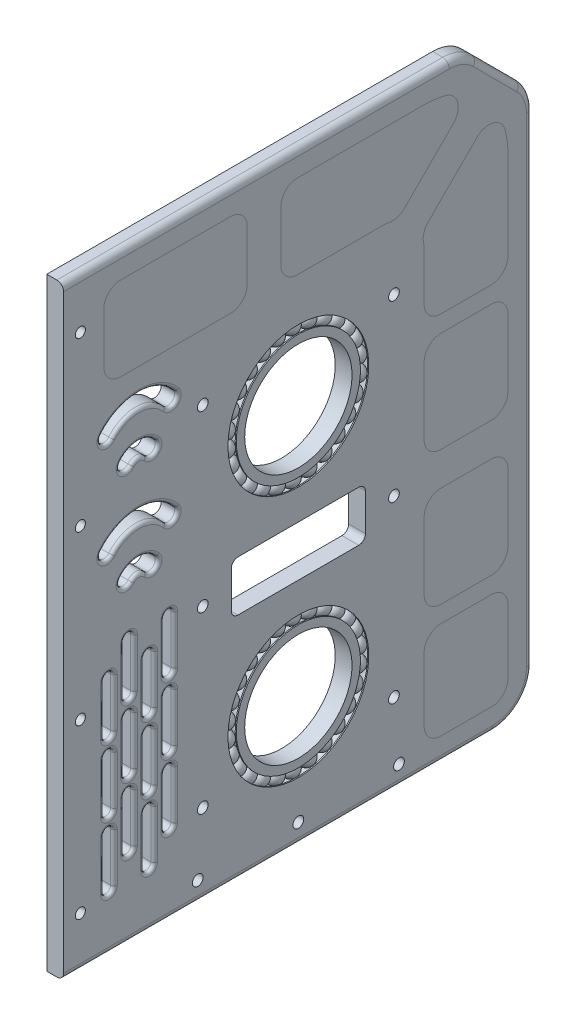
from build123d import *

# Parameters (mm, degrees)
SKETCH1_W             = 140
SKETCH1_H             = 180
BOSS_EXTRUDE1_DEPTH   = 5
CHAMFER1_SIZE         = 20
FILLET6_R             = 12
SKETCH18_R            = 23.5
CUT_EXTRUDE4_DEPTH    = 115.127122105
F_3_0MM_DOWEL_HOLE1_D = 3
CIRPATTERN2_COUNT     = 26
SKETCH33_R            = 1.6
CUT_EXTRUDE6_DEPTH    = 115.127122105
CUT_EXTRUDE7_DEPTH    = 5
SKETCH35_W            = 42.75
SKETCH35_H            = 25
SKETCH35_W_2          = 25
SKETCH35_H_2          = 30
CUT_EXTRUDE8_DEPTH    = 115.127122105
FILLET4_R             = 5
BOSS_EXTRUDE4_DEPTH   = 5
BOSS_EXTRUDE4_2_DEPTH = 5
BOSS_EXTRUDE4_3_DEPTH = 5
BOSS_EXTRUDE4_4_DEPTH = 5
BOSS_EXTRUDE4_5_DEPTH = 5
BOSS_EXTRUDE4_6_DEPTH = 5
SKETCH37_R            = 1.6
CUT_EXTRUDE9_DEPTH    = 115.127122105
FILLET5_R             = 2
FILLET7_R             = 1


with BuildPart() as part:
    # Sketch1 → Boss-Extrude1 (new body)
    with BuildSketch(Plane(origin=(0, 0, 0), x_dir=(0, 0, -1), z_dir=(1, 0, 0))):
        Rectangle(SKETCH1_W, SKETCH1_H)
    extrude(amount=BOSS_EXTRUDE1_DEPTH)

    # Chamfer1
    chamfer1_edges = [part.edges().sort_by_distance(p)[0] for p in [
        (2.5, 90, -70),
    ]]
    chamfer(chamfer1_edges, length=CHAMFER1_SIZE)

    # Fillet6
    fillet6_edges = [part.edges().sort_by_distance(p)[0] for p in [
        (2.5, 90, -50),
        (2.5, 70, -70),
        (2.5, -90, -70),
    ]]
    fillet(fillet6_edges, radius=FILLET6_R)

    # Sketch18 → Cut-Extrude4 (cut, through all)
    with BuildSketch(Plane(origin=(5, 0, 0), x_dir=(0, 0, -1), z_dir=(1, 0, 0))):
        with Locations((0, 23.5)):
            Circle(SKETCH18_R)
        with Locations((0, -51.5)):
            Circle(SKETCH18_R)
    extrude(amount=-CUT_EXTRUDE4_DEPTH, mode=Mode.SUBTRACT)

    # Ø3.0mm Dowel Hole1 (through all)
    with Locations(Plane(origin=(5, 0, 0), x_dir=(0, 0, -1), z_dir=(1, 0, 0))):
        with Locations((-65, -75), (-65, -25), (-65, 25), (-65, 75)):
            Hole(F_3_0MM_DOWEL_HOLE1_D / 2)


with BuildPart() as body_2:
    # Sketch19 → Revolve1 (revolve)
    with BuildSketch(Plane.XY, mode=Mode.PRIVATE) as revolve1_sk:
        with BuildLine():
            Line((5, 47), (0, 47))
            Line((0, 47), (0, 44.5))
            Line((0, 44.5), (0.334936491, 44.5))
            ThreePointArc((0.334936491, 44.5), (2.5, 45.75), (4.665063509, 44.5))
            Line((4.665063509, 44.5), (5, 44.5))
            Line((5, 44.5), (5, 47))
        make_face()
        with BuildLine():
            Line((5, 39.5), (0, 39.5))
            Line((0, 39.5), (0, 42))
            Line((0, 42), (0.334936491, 42))
            ThreePointArc((0.334936491, 42), (2.5, 40.75), (4.665063509, 42))
            Line((4.665063509, 42), (5, 42))
            Line((5, 42), (5, 39.5))
        make_face()
    revolve(revolve1_sk.sketch.rotate(Axis((5.915063509, 23.5, 0), (1, 0, 0)), 90), axis=Axis((5.915063509, 23.5, 0), (1, 0, 0)))


with BuildPart() as body_3:
    # Sketch20 → Revolve2 (revolve)
    with BuildSketch(Plane.XY):
        with BuildLine():
            Line((4.89, 43.25), (0.11, 43.25))
            ThreePointArc((0.11, 43.25), (2.5, 40.86), (4.89, 43.25))
        make_face()
    revolve(axis=Axis((6.375608652, 43.25, 0), (-1, 0, 0)))


with BuildPart() as cirpattern2_1:
    # CirPattern2: pattern copy
    add(body_3.part.rotate(Axis((0, 23.5, 0), (1, 0, 0)), 1 * 360 / CIRPATTERN2_COUNT))


with BuildPart() as cirpattern2_2:
    # CirPattern2: pattern copy
    add(body_3.part.rotate(Axis((0, 23.5, 0), (1, 0, 0)), 2 * 360 / CIRPATTERN2_COUNT))


with BuildPart() as cirpattern2_3:
    # CirPattern2: pattern copy
    add(body_3.part.rotate(Axis((0, 23.5, 0), (1, 0, 0)), 3 * 360 / CIRPATTERN2_COUNT))


with BuildPart() as cirpattern2_4:
    # CirPattern2: pattern copy
    add(body_3.part.rotate(Axis((0, 23.5, 0), (1, 0, 0)), 4 * 360 / CIRPATTERN2_COUNT))


with BuildPart() as cirpattern2_5:
    # CirPattern2: pattern copy
    add(body_3.part.rotate(Axis((0, 23.5, 0), (1, 0, 0)), 5 * 360 / CIRPATTERN2_COUNT))


with BuildPart() as cirpattern2_6:
    # CirPattern2: pattern copy
    add(body_3.part.rotate(Axis((0, 23.5, 0), (1, 0, 0)), 6 * 360 / CIRPATTERN2_COUNT))


with BuildPart() as cirpattern2_7:
    # CirPattern2: pattern copy
    add(body_3.part.rotate(Axis((0, 23.5, 0), (1, 0, 0)), 7 * 360 / CIRPATTERN2_COUNT))


with BuildPart() as cirpattern2_8:
    # CirPattern2: pattern copy
    add(body_3.part.rotate(Axis((0, 23.5, 0), (1, 0, 0)), 8 * 360 / CIRPATTERN2_COUNT))


with BuildPart() as cirpattern2_9:
    # CirPattern2: pattern copy
    add(body_3.part.rotate(Axis((0, 23.5, 0), (1, 0, 0)), 9 * 360 / CIRPATTERN2_COUNT))


with BuildPart() as cirpattern2_10:
    # CirPattern2: pattern copy
    add(body_3.part.rotate(Axis((0, 23.5, 0), (1, 0, 0)), 10 * 360 / CIRPATTERN2_COUNT))


with BuildPart() as cirpattern2_11:
    # CirPattern2: pattern copy
    add(body_3.part.rotate(Axis((0, 23.5, 0), (1, 0, 0)), 11 * 360 / CIRPATTERN2_COUNT))


with BuildPart() as cirpattern2_12:
    # CirPattern2: pattern copy
    add(body_3.part.rotate(Axis((0, 23.5, 0), (1, 0, 0)), 12 * 360 / CIRPATTERN2_COUNT))


with BuildPart() as cirpattern2_13:
    # CirPattern2: pattern copy
    add(body_3.part.rotate(Axis((0, 23.5, 0), (1, 0, 0)), 13 * 360 / CIRPATTERN2_COUNT))


with BuildPart() as cirpattern2_14:
    # CirPattern2: pattern copy
    add(body_3.part.rotate(Axis((0, 23.5, 0), (1, 0, 0)), 14 * 360 / CIRPATTERN2_COUNT))


with BuildPart() as cirpattern2_15:
    # CirPattern2: pattern copy
    add(body_3.part.rotate(Axis((0, 23.5, 0), (1, 0, 0)), 15 * 360 / CIRPATTERN2_COUNT))


with BuildPart() as cirpattern2_16:
    # CirPattern2: pattern copy
    add(body_3.part.rotate(Axis((0, 23.5, 0), (1, 0, 0)), 16 * 360 / CIRPATTERN2_COUNT))


with BuildPart() as cirpattern2_17:
    # CirPattern2: pattern copy
    add(body_3.part.rotate(Axis((0, 23.5, 0), (1, 0, 0)), 17 * 360 / CIRPATTERN2_COUNT))


with BuildPart() as cirpattern2_18:
    # CirPattern2: pattern copy
    add(body_3.part.rotate(Axis((0, 23.5, 0), (1, 0, 0)), 18 * 360 / CIRPATTERN2_COUNT))


with BuildPart() as cirpattern2_19:
    # CirPattern2: pattern copy
    add(body_3.part.rotate(Axis((0, 23.5, 0), (1, 0, 0)), 19 * 360 / CIRPATTERN2_COUNT))


with BuildPart() as cirpattern2_20:
    # CirPattern2: pattern copy
    add(body_3.part.rotate(Axis((0, 23.5, 0), (1, 0, 0)), 20 * 360 / CIRPATTERN2_COUNT))


with BuildPart() as cirpattern2_21:
    # CirPattern2: pattern copy
    add(body_3.part.rotate(Axis((0, 23.5, 0), (1, 0, 0)), 21 * 360 / CIRPATTERN2_COUNT))


with BuildPart() as cirpattern2_22:
    # CirPattern2: pattern copy
    add(body_3.part.rotate(Axis((0, 23.5, 0), (1, 0, 0)), 22 * 360 / CIRPATTERN2_COUNT))


with BuildPart() as cirpattern2_23:
    # CirPattern2: pattern copy
    add(body_3.part.rotate(Axis((0, 23.5, 0), (1, 0, 0)), 23 * 360 / CIRPATTERN2_COUNT))


with BuildPart() as cirpattern2_24:
    # CirPattern2: pattern copy
    add(body_3.part.rotate(Axis((0, 23.5, 0), (1, 0, 0)), 24 * 360 / CIRPATTERN2_COUNT))


with BuildPart() as cirpattern2_25:
    # CirPattern2: pattern copy
    add(body_3.part.rotate(Axis((0, 23.5, 0), (1, 0, 0)), 25 * 360 / CIRPATTERN2_COUNT))


with BuildPart() as body_29:
    # Mirror4: mirrored copy
    add(body_2.part.mirror(Plane.ZX.offset(-14)))


with BuildPart() as body_30:
    # Mirror4 2: mirrored copy
    add(body_3.part.mirror(Plane.ZX.offset(-14)))


with BuildPart() as body_31:
    # Mirror4 3: mirrored copy
    add(cirpattern2_1.part.mirror(Plane.ZX.offset(-14)))


with BuildPart() as body_32:
    # Mirror4 4: mirrored copy
    add(cirpattern2_2.part.mirror(Plane.ZX.offset(-14)))


with BuildPart() as body_33:
    # Mirror4 5: mirrored copy
    add(cirpattern2_3.part.mirror(Plane.ZX.offset(-14)))


with BuildPart() as body_34:
    # Mirror4 6: mirrored copy
    add(cirpattern2_4.part.mirror(Plane.ZX.offset(-14)))


with BuildPart() as body_35:
    # Mirror4 7: mirrored copy
    add(cirpattern2_5.part.mirror(Plane.ZX.offset(-14)))


with BuildPart() as body_36:
    # Mirror4 8: mirrored copy
    add(cirpattern2_6.part.mirror(Plane.ZX.offset(-14)))


with BuildPart() as body_37:
    # Mirror4 9: mirrored copy
    add(cirpattern2_7.part.mirror(Plane.ZX.offset(-14)))


with BuildPart() as body_38:
    # Mirror4 10: mirrored copy
    add(cirpattern2_8.part.mirror(Plane.ZX.offset(-14)))


with BuildPart() as body_39:
    # Mirror4 11: mirrored copy
    add(cirpattern2_9.part.mirror(Plane.ZX.offset(-14)))


with BuildPart() as body_40:
    # Mirror4 12: mirrored copy
    add(cirpattern2_10.part.mirror(Plane.ZX.offset(-14)))


with BuildPart() as body_41:
    # Mirror4 13: mirrored copy
    add(cirpattern2_11.part.mirror(Plane.ZX.offset(-14)))


with BuildPart() as body_42:
    # Mirror4 14: mirrored copy
    add(cirpattern2_12.part.mirror(Plane.ZX.offset(-14)))


with BuildPart() as body_43:
    # Mirror4 15: mirrored copy
    add(cirpattern2_13.part.mirror(Plane.ZX.offset(-14)))


with BuildPart() as body_44:
    # Mirror4 16: mirrored copy
    add(cirpattern2_14.part.mirror(Plane.ZX.offset(-14)))


with BuildPart() as body_45:
    # Mirror4 17: mirrored copy
    add(cirpattern2_15.part.mirror(Plane.ZX.offset(-14)))


with BuildPart() as body_46:
    # Mirror4 18: mirrored copy
    add(cirpattern2_16.part.mirror(Plane.ZX.offset(-14)))


with BuildPart() as body_47:
    # Mirror4 19: mirrored copy
    add(cirpattern2_17.part.mirror(Plane.ZX.offset(-14)))


with BuildPart() as body_48:
    # Mirror4 20: mirrored copy
    add(cirpattern2_18.part.mirror(Plane.ZX.offset(-14)))


with BuildPart() as body_49:
    # Mirror4 21: mirrored copy
    add(cirpattern2_19.part.mirror(Plane.ZX.offset(-14)))


with BuildPart() as body_50:
    # Mirror4 22: mirrored copy
    add(cirpattern2_20.part.mirror(Plane.ZX.offset(-14)))


with BuildPart() as body_51:
    # Mirror4 23: mirrored copy
    add(cirpattern2_21.part.mirror(Plane.ZX.offset(-14)))


with BuildPart() as body_52:
    # Mirror4 24: mirrored copy
    add(cirpattern2_22.part.mirror(Plane.ZX.offset(-14)))


with BuildPart() as body_53:
    # Mirror4 25: mirrored copy
    add(cirpattern2_23.part.mirror(Plane.ZX.offset(-14)))


with BuildPart() as body_54:
    # Mirror4 26: mirrored copy
    add(cirpattern2_24.part.mirror(Plane.ZX.offset(-14)))


with BuildPart() as body_55:
    # Mirror4 27: mirrored copy
    add(cirpattern2_25.part.mirror(Plane.ZX.offset(-14)))


with BuildPart() as part_1:
    add(part.part)

    # Intersect1: read off the stored shape, not the designer's step
    # Intersect1: union body 29, body 2
    add(body_29.part)
    add(body_2.part)

    # Sketch33 → Cut-Extrude6 (cut, through all)
    with BuildSketch(Plane(origin=(5, 0, 0), x_dir=(0, 0, -1), z_dir=(1, 0, 0))):
        with Locations((-28.5, -14)):
            Circle(SKETCH33_R)
        with Locations((-28.5, -66)):
            Circle(SKETCH33_R)
        with Locations(Location((-28.5, 38, 0), (0, 0, 180))):
            Circle(SKETCH33_R)
        with Locations((28.5, 38)):
            Circle(SKETCH33_R)
        with Locations(Location((28.5, -66, 0), (0, 0, 180))):
            Circle(SKETCH33_R)
        with Locations(Location((28.5, -14, 0), (0, 0, 180))):
            Circle(SKETCH33_R)
    extrude(amount=-CUT_EXTRUDE6_DEPTH, mode=Mode.SUBTRACT)

    # Sketch34 → Cut-Extrude7 (cut)
    with BuildSketch(Plane(origin=(5, 0, 0), x_dir=(0, 0, -1), z_dir=(1, 0, 0))):
        with BuildLine():
            Line((-40, -66), (-40, -51.5))
            ThreePointArc((-40, -51.5), (-38.5, -50), (-37, -51.5))
            Line((-37, -51.5), (-37, -66))
            ThreePointArc((-37, -66), (-38.5, -67.5), (-40, -66))
        make_face()
        with BuildLine():
            Line((-18, -6.5), (18, -6.5))
            ThreePointArc((18, -6.5), (19.414213562, -7.085786438), (20, -8.5))
            Line((20, -8.5), (20, -19.5))
            ThreePointArc((20, -19.5), (19.414213562, -20.914213562), (18, -21.5))
            Line((18, -21.5), (-18, -21.5))
            ThreePointArc((-18, -21.5), (-19.414213562, -20.914213562), (-20, -19.5))
            Line((-20, -19.5), (-20, -8.5))
            ThreePointArc((-20, -8.5), (-19.414213562, -7.085786438), (-18, -6.5))
        make_face()
        with BuildLine():
            Line((-40, -46), (-40, -31.5))
            ThreePointArc((-40, -31.5), (-38.5, -30), (-37, -31.5))
            Line((-37, -31.5), (-37, -46))
            ThreePointArc((-37, -46), (-38.5, -47.5), (-40, -46))
        make_face()
        with BuildLine():
            Line((-40, -26), (-40, -11.5))
            ThreePointArc((-40, -11.5), (-38.5, -10), (-37, -11.5))
            Line((-37, -11.5), (-37, -26))
            ThreePointArc((-37, -26), (-38.5, -27.5), (-40, -26))
        make_face()
        with BuildLine():
            Line((-46, -73.25), (-46, -58.75))
            ThreePointArc((-46, -58.75), (-44.5, -57.25), (-43, -58.75))
            Line((-43, -58.75), (-43, -73.25))
            ThreePointArc((-43, -73.25), (-44.5, -74.75), (-46, -73.25))
        make_face()
        with BuildLine():
            Line((-46, -53.25), (-46, -38.75))
            ThreePointArc((-46, -38.75), (-44.5, -37.25), (-43, -38.75))
            Line((-43, -38.75), (-43, -53.25))
            ThreePointArc((-43, -53.25), (-44.5, -54.75), (-46, -53.25))
        make_face()
        with BuildLine():
            Line((-46, -33.25), (-46, -18.75))
            ThreePointArc((-46, -18.75), (-44.5, -17.25), (-43, -18.75))
            Line((-43, -18.75), (-43, -33.25))
            ThreePointArc((-43, -33.25), (-44.5, -34.75), (-46, -33.25))
        make_face()
        with BuildLine():
            Line((-52, -66), (-52, -51.5))
            ThreePointArc((-52, -51.5), (-50.5, -50), (-49, -51.5))
            Line((-49, -51.5), (-49, -66))
            ThreePointArc((-49, -66), (-50.5, -67.5), (-52, -66))
        make_face()
        with BuildLine():
            Line((-52, -46), (-52, -31.5))
            ThreePointArc((-52, -31.5), (-50.5, -30), (-49, -31.5))
            Line((-49, -31.5), (-49, -46))
            ThreePointArc((-49, -46), (-50.5, -47.5), (-52, -46))
        make_face()
        with BuildLine():
            Line((-52, -26), (-52, -11.5))
            ThreePointArc((-52, -11.5), (-50.5, -10), (-49, -11.5))
            Line((-49, -11.5), (-49, -26))
            ThreePointArc((-49, -26), (-50.5, -27.5), (-52, -26))
        make_face()
        with BuildLine():
            Line((-58, -73.25), (-58, -58.75))
            ThreePointArc((-58, -58.75), (-56.5, -57.25), (-55, -58.75))
            Line((-55, -58.75), (-55, -73.25))
            ThreePointArc((-55, -73.25), (-56.5, -74.75), (-58, -73.25))
        make_face()
        with BuildLine():
            Line((-58, -53.25), (-58, -38.75))
            ThreePointArc((-58, -38.75), (-56.5, -37.25), (-55, -38.75))
            Line((-55, -38.75), (-55, -53.25))
            ThreePointArc((-55, -53.25), (-56.5, -54.75), (-58, -53.25))
        make_face()
        with BuildLine():
            Line((-58, -33.25), (-58, -18.75))
            ThreePointArc((-58, -18.75), (-56.5, -17.25), (-55, -18.75))
            Line((-55, -18.75), (-55, -33.25))
            ThreePointArc((-55, -33.25), (-56.5, -34.75), (-58, -33.25))
        make_face()
        with BuildLine():
            ThreePointArc((-42.137688898, 5.499513268), (-47.5, 8), (-52.862311102, 5.499513268))
            ThreePointArc((-52.862311102, 5.499513268), (-52.615797435, 2.681849162), (-49.798133329, 2.928362829))
            ThreePointArc((-49.798133329, 2.928362829), (-47.5, 4), (-45.201866671, 2.928362829))
            ThreePointArc((-45.201866671, 2.928362829), (-42.384202565, 2.681849162), (-42.137688898, 5.499513268))
        make_face()
        with BuildLine():
            ThreePointArc((-36.392355575, 15.32042034), (-47.5, 20.5), (-58.607644425, 15.32042034))
            ThreePointArc((-58.607644425, 15.32042034), (-58.361130758, 12.502756235), (-55.543466653, 12.749269902))
            ThreePointArc((-55.543466653, 12.749269902), (-47.5, 16.5), (-39.456533347, 12.749269902))
            ThreePointArc((-39.456533347, 12.749269902), (-36.638869242, 12.502756235), (-36.392355575, 15.32042034))
        make_face()
        with BuildLine():
            ThreePointArc((-42.137688898, 35.499513268), (-47.5, 38), (-52.862311102, 35.499513268))
            ThreePointArc((-52.862311102, 35.499513268), (-52.615797435, 32.681849162), (-49.798133329, 32.928362829))
            ThreePointArc((-49.798133329, 32.928362829), (-47.5, 34), (-45.201866671, 32.928362829))
            ThreePointArc((-45.201866671, 32.928362829), (-42.384202565, 32.681849162), (-42.137688898, 35.499513268))
        make_face()
        with BuildLine():
            ThreePointArc((-36.392355575, 45.32042034), (-47.5, 50.5), (-58.607644425, 45.32042034))
            ThreePointArc((-58.607644425, 45.32042034), (-58.361130758, 42.502756235), (-55.543466653, 42.749269902))
            ThreePointArc((-55.543466653, 42.749269902), (-47.5, 46.5), (-39.456533347, 42.749269902))
            ThreePointArc((-39.456533347, 42.749269902), (-36.638869242, 42.502756235), (-36.392355575, 45.32042034))
        make_face()
    extrude(amount=-CUT_EXTRUDE7_DEPTH, mode=Mode.SUBTRACT)

    # Sketch35 → Cut-Extrude8 (cut, through all)
    with BuildSketch(Plane(origin=(5, 0, 0), x_dir=(0, 0, -1), z_dir=(1, 0, 0))):
        with BuildLine():
            Line((37.5, -78.073825812), (37.5, -83))
            Line((37.5, -83), (50, -83))
            Line((50, -83), (58.356041982, -83))
            ThreePointArc((58.356041982, -83), (61.326239009, -81.292504897), (62.5, -78.073825812))
            Line((62.5, -78.073825812), (62.5, -54))
            Line((62.5, -54), (37.5, -54))
            Line((37.5, -54), (37.5, -78.073825812))
        make_face()
        with BuildLine():
            Line((37.5, 82.5), (-5.25, 82.5))
            Line((-5.25, 82.5), (-5.25, 57.5))
            Line((-5.25, 57.5), (25, 57.5))
            ThreePointArc((25, 57.5), (27.323171621, 57.282217781), (29.565391967, 56.636459779))
            Line((29.565391967, 56.636459779), (51.28497417, 78.356041982))
            ThreePointArc((51.28497417, 78.356041982), (44.69718523, 81.441606562), (37.5, 82.5))
        make_face()
        with Locations((-36.625, 70)):
            Rectangle(SKETCH35_W, SKETCH35_H)
        with Locations((50, -34)):
            Rectangle(SKETCH35_W_2, SKETCH35_H_2)
        with Locations((50, 6)):
            Rectangle(SKETCH35_W_2, SKETCH35_H_2)
        with BuildLine():
            Line((36.636459779, 49.565391967), (58.356041982, 71.28497417))
            ThreePointArc((58.356041982, 71.28497417), (61.441606562, 64.69718523), (62.5, 57.5))
            Line((62.5, 57.5), (62.5, 26))
            Line((62.5, 26), (37.5, 26))
            Line((37.5, 26), (37.5, 45))
            ThreePointArc((37.5, 45), (37.282217781, 47.323171621), (36.636459779, 49.565391967))
        make_face()
    extrude(amount=-CUT_EXTRUDE8_DEPTH, mode=Mode.SUBTRACT)

    # Fillet4
    fillet4_edges = [part_1.edges().sort_by_distance(p)[0] for p in [
        (2.5, -83, -37.5),
        (2.5, -54, -37.5),
        (2.5, -54, -62.5),
        (2.5, -9, -37.5),
        (2.5, 21, -37.5),
        (2.5, 21, -62.5),
        (2.5, -9, -62.5),
        (2.5, 78.356041982, -51.28497417),
        (2.5, 56.636459779, -29.565391967),
        (2.5, 57.5, 5.25),
        (2.5, 82.5, 5.25),
        (2.5, 71.28497417, -58.356041982),
        (2.5, 26, -62.5),
        (2.5, 26, -37.5),
        (2.5, 49.565391967, -36.636459779),
        (2.5, 82.5, 58),
        (2.5, 82.5, 15.25),
        (2.5, 57.5, 15.25),
        (2.5, 57.5, 58),
        (2.5, -49, -37.5),
        (2.5, -19, -37.5),
        (2.5, -19, -62.5),
        (2.5, -49, -62.5),
    ]]
    fillet(fillet4_edges, radius=FILLET4_R)

    # Sketch37 → Cut-Extrude9 (cut, through all)
    with BuildSketch(Plane(origin=(5, 0, 0), x_dir=(0, 0, -1), z_dir=(1, 0, 0))):
        with Locations((30, -84)):
            Circle(SKETCH37_R)
        with Locations((0, -84)):
            Circle(SKETCH37_R)
        with Locations(Location((-30, -84, 0), (0, 0, 180))):
            Circle(SKETCH37_R)
    extrude(amount=-CUT_EXTRUDE9_DEPTH, mode=Mode.SUBTRACT)

    # Fillet5
    fillet5_edges = [part_1.edges().sort_by_distance(p)[0] for p in [
        (5, -90, 6),
        (5, -86.485281374, -66.485281374),
        (5, -6.485281374, -70),
        (5, 69.62163844, -69.08655439),
        (5, 80, -60),
        (5, 89.08655439, -49.62163844),
        (5, 90, 12.485281374),
    ]]
    fillet(fillet5_edges, radius=FILLET5_R)

    # Fillet7
    fillet7_edges = [part_1.edges().sort_by_distance(p)[0] for p in [
        (5, -47.5, 50.5),
        (5, -38.75, 49),
        (5, -30, 50.5),
        (5, -38.75, 52),
        (5, -67.5, 50.5),
        (5, -58.75, 49),
        (5, -50, 50.5),
        (5, -58.75, 52),
        (5, -34.75, 44.5),
        (5, -26, 43),
        (5, -17.25, 44.5),
        (5, -26, 46),
        (5, -54.75, 44.5),
        (5, -46, 43),
        (5, -37.25, 44.5),
        (5, -46, 46),
        (5, -47.5, 38.5),
        (5, -38.75, 37),
        (5, -30, 38.5),
        (5, -38.75, 40),
        (5, -27.5, 38.5),
        (5, -18.75, 37),
        (5, -10, 38.5),
        (5, -18.75, 40),
        (5, -74.75, 44.5),
        (5, -66, 43),
        (5, -57.25, 44.5),
        (5, -66, 46),
        (5, -34.75, 56.5),
        (5, -26, 55),
        (5, -17.25, 56.5),
        (5, -26, 58),
        (5, -54.75, 56.5),
        (5, -46, 55),
        (5, -37.25, 56.5),
        (5, -46, 58),
        (5, -74.75, 56.5),
        (5, -66, 55),
        (5, -57.25, 56.5),
        (5, -66, 58),
        (5, -27.5, 50.5),
        (5, -18.75, 49),
        (5, -10, 50.5),
        (5, -18.75, 52),
        (5, 2.681849162, 42.384202565),
        (5, 8, 47.5),
        (5, 2.681849162, 52.615797435),
        (5, 4, 47.5),
        (5, 12.502756235, 36.638869242),
        (5, 20.5, 47.5),
        (5, 12.502756235, 58.361130758),
        (5, 16.5, 47.5),
        (5, 32.681849162, 42.384202565),
        (5, 38, 47.5),
        (5, 32.681849162, 52.615797435),
        (5, 34, 47.5),
        (5, 42.502756235, 36.638869242),
        (5, 50.5, 47.5),
        (5, 42.502756235, 58.361130758),
        (5, 46.5, 47.5),
        (5, -67.5, 38.5),
        (5, -58.75, 37),
        (5, -50, 38.5),
        (5, -58.75, 40),
    ]]
    fillet(fillet7_edges, radius=FILLET7_R)


with BuildPart() as body_54_2:
    # Sketch36 → Boss-Extrude4 (new body)
    with BuildSketch(Plane(origin=(5, 0, 0), x_dir=(0, 0, -1), z_dir=(1, 0, 0))):
        with BuildLine():
            Line((42.5, -49), (57.5, -49))
            ThreePointArc((57.5, -49), (61.035533906, -47.535533906), (62.5, -44))
            Line((62.5, -44), (62.5, -24))
            ThreePointArc((62.5, -24), (61.035533906, -20.464466094), (57.5, -19))
            Line((57.5, -19), (42.5, -19))
            ThreePointArc((42.5, -19), (38.964466094, -20.464466094), (37.5, -24))
            Line((37.5, -24), (37.5, -44))
            ThreePointArc((37.5, -44), (38.964466094, -47.535533906), (42.5, -49))
        make_face()
    extrude(amount=-BOSS_EXTRUDE4_DEPTH)


with BuildPart() as body_55_2:
    # Sketch36 → Boss-Extrude4 2 (new body)
    with BuildSketch(Plane(origin=(5, 0, 0), x_dir=(0, 0, -1), z_dir=(1, 0, 0))):
        with BuildLine():
            Line((-58, 77.5), (-58, 62.5))
            ThreePointArc((-58, 62.5), (-56.535533906, 58.964466094), (-53, 57.5))
            Line((-53, 57.5), (-20.25, 57.5))
            ThreePointArc((-20.25, 57.5), (-16.714466094, 58.964466094), (-15.25, 62.5))
            Line((-15.25, 62.5), (-15.25, 77.5))
            ThreePointArc((-15.25, 77.5), (-16.714466094, 81.035533906), (-20.25, 82.5))
            Line((-20.25, 82.5), (-53, 82.5))
            ThreePointArc((-53, 82.5), (-56.535533906, 81.035533906), (-58, 77.5))
        make_face()
    extrude(amount=-BOSS_EXTRUDE4_2_DEPTH)


with BuildPart() as body_56:
    # Sketch36 → Boss-Extrude4 3 (new body)
    with BuildSketch(Plane(origin=(5, 0, 0), x_dir=(0, 0, -1), z_dir=(1, 0, 0))):
        with BuildLine():
            Line((53.28298262, 66.211914808), (38.690581912, 51.6195141))
            ThreePointArc((38.690581912, 51.6195141), (37.455565788, 49.58126187), (37.304368441, 47.202842996))
            ThreePointArc((37.304368441, 47.202842996), (37.450996055, 46.105756412), (37.5, 45))
            Line((37.5, 45), (37.5, 31))
            ThreePointArc((37.5, 31), (38.964466094, 27.464466094), (42.5, 26))
            Line((42.5, 26), (57.5, 26))
            ThreePointArc((57.5, 26), (61.035533906, 27.464466094), (62.5, 31))
            Line((62.5, 31), (62.5, 57.5))
            ThreePointArc((62.5, 57.5), (62.286121534, 60.763154806), (61.648145657, 63.970476128))
            ThreePointArc((61.648145657, 63.970476128), (58.112611751, 67.506010033), (53.28298262, 66.211914808))
        make_face()
    extrude(amount=-BOSS_EXTRUDE4_3_DEPTH)


with BuildPart() as body_57:
    # Sketch36 → Boss-Extrude4 4 (new body)
    with BuildSketch(Plane(origin=(5, 0, 0), x_dir=(0, 0, -1), z_dir=(1, 0, 0))):
        with BuildLine():
            Line((37.5, 82.5), (-0.25, 82.5))
            ThreePointArc((-0.25, 82.5), (-3.785533906, 81.035533906), (-5.25, 77.5))
            Line((-5.25, 77.5), (-5.25, 62.5))
            ThreePointArc((-5.25, 62.5), (-3.785533906, 58.964466094), (-0.25, 57.5))
            Line((-0.25, 57.5), (25, 57.5))
            ThreePointArc((25, 57.5), (26.105756412, 57.450996055), (27.202842996, 57.304368441))
            ThreePointArc((27.202842996, 57.304368441), (29.58126187, 57.455565788), (31.6195141, 58.690581912))
            Line((31.6195141, 58.690581912), (46.211914808, 73.28298262))
            ThreePointArc((46.211914808, 73.28298262), (47.506010033, 78.112611751), (43.970476128, 81.648145657))
            ThreePointArc((43.970476128, 81.648145657), (40.763154806, 82.286121534), (37.5, 82.5))
        make_face()
    extrude(amount=-BOSS_EXTRUDE4_4_DEPTH)


with BuildPart() as body_58:
    # Sketch36 → Boss-Extrude4 5 (new body)
    with BuildSketch(Plane(origin=(5, 0, 0), x_dir=(0, 0, -1), z_dir=(1, 0, 0))):
        with BuildLine():
            Line((42.5, -9), (57.5, -9))
            ThreePointArc((57.5, -9), (61.035533906, -7.535533906), (62.5, -4))
            Line((62.5, -4), (62.5, 16))
            ThreePointArc((62.5, 16), (61.035533906, 19.535533906), (57.5, 21))
            Line((57.5, 21), (42.5, 21))
            ThreePointArc((42.5, 21), (38.964466094, 19.535533906), (37.5, 16))
            Line((37.5, 16), (37.5, -4))
            ThreePointArc((37.5, -4), (38.964466094, -7.535533906), (42.5, -9))
        make_face()
    extrude(amount=-BOSS_EXTRUDE4_5_DEPTH)


with BuildPart() as body_59:
    # Sketch36 → Boss-Extrude4 6 (new body)
    with BuildSketch(Plane(origin=(5, 0, 0), x_dir=(0, 0, -1), z_dir=(1, 0, 0))):
        with BuildLine():
            Line((62.5, -78.073825812), (62.5, -59))
            ThreePointArc((62.5, -59), (61.035533906, -55.464466094), (57.5, -54))
            Line((57.5, -54), (42.5, -54))
            ThreePointArc((42.5, -54), (38.964466094, -55.464466094), (37.5, -59))
            Line((37.5, -59), (37.5, -78))
            ThreePointArc((37.5, -78), (38.964466094, -81.535533906), (42.5, -83))
            Line((42.5, -83), (58.356041982, -83))
            ThreePointArc((58.356041982, -83), (61.326239009, -81.292504897), (62.5, -78.073825812))
        make_face()
    extrude(amount=-BOSS_EXTRUDE4_6_DEPTH)


solid = Compound([body_3.part, cirpattern2_1.part, cirpattern2_2.part, cirpattern2_3.part, cirpattern2_4.part, cirpattern2_5.part, cirpattern2_6.part, cirpattern2_7.part, cirpattern2_8.part, cirpattern2_9.part, cirpattern2_10.part, cirpattern2_11.part, cirpattern2_12.part, cirpattern2_13.part, cirpattern2_14.part, cirpattern2_15.part, cirpattern2_16.part, cirpattern2_17.part, cirpattern2_18.part, cirpattern2_19.part, cirpattern2_20.part, cirpattern2_21.part, cirpattern2_22.part, cirpattern2_23.part, cirpattern2_24.part, cirpattern2_25.part, body_30.part, body_31.part, body_32.part, body_33.part, body_34.part, body_35.part, body_36.part, body_37.part, body_38.part, body_39.part, body_40.part, body_41.part, body_42.part, body_43.part, body_44.part, body_45.part, body_46.part, body_47.part, body_48.part, body_49.part, body_50.part, body_51.part, body_52.part, body_53.part, body_54.part, body_55.part, part_1.part, body_54_2.part, body_55_2.part, body_56.part, body_57.part, body_58.part, body_59.part])
